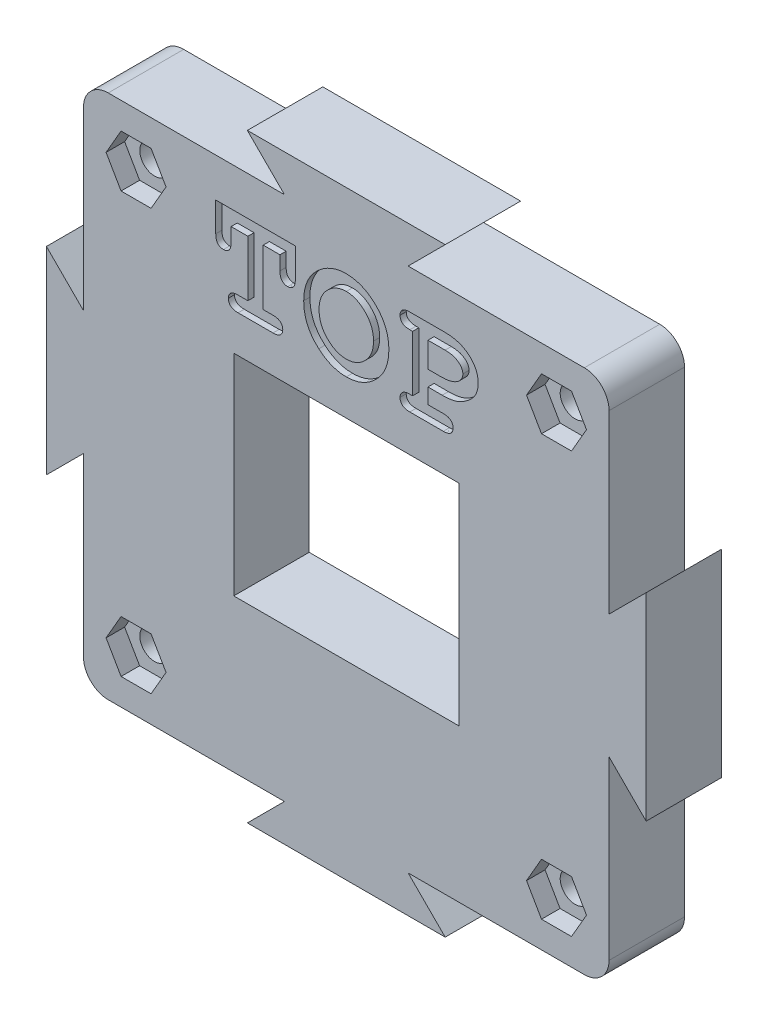
from build123d import *

# Parameters (mm, degrees)
SKETCH1_R           = 1.2
SKETCH1_W           = 18.2
SKETCH1_H           = 17
BOSS_EXTRUDE1_DEPTH = 6.1
CUT_EXTRUDE3_DEPTH  = 1
CUT_EXTRUDE4_DEPTH  = 1.5
CUT_EXTRUDE5_DEPTH  = 0.5


with BuildPart() as part:
    # Sketch1 → Boss-Extrude1 (new body)
    with BuildSketch(Plane.XY):
        with BuildLine():
            Line((-5, 21.25), (-19.25, 21.25))
            ThreePointArc((-19.25, 21.25), (-20.664213562, 20.664213562), (-21.25, 19.25))
            Line((-21.25, 19.25), (-21.25, 5))
            Line((-21.25, 5), (-24.25, 8))
            Line((-24.25, 8), (-24.25, -8))
            Line((-24.25, -8), (-21.25, -5))
            Line((-21.25, -5), (-21.25, -19.25))
            ThreePointArc((-21.25, -19.25), (-20.664213562, -20.664213562), (-19.25, -21.25))
            Line((-19.25, -21.25), (-5, -21.25))
            Line((-5, -21.25), (-8, -24.25))
            Line((-8, -24.25), (8, -24.25))
            Line((8, -24.25), (5, -21.25))
            Line((5, -21.25), (19.25, -21.25))
            ThreePointArc((19.25, -21.25), (20.664213562, -20.664213562), (21.25, -19.25))
            Line((21.25, -19.25), (21.25, -5))
            Line((21.25, -5), (24.25, -8))
            Line((24.25, -8), (24.25, 8))
            Line((24.25, 8), (21.25, 5))
            Line((21.25, 5), (21.25, 19.25))
            ThreePointArc((21.25, 19.25), (20.664213562, 20.664213562), (19.25, 21.25))
            Line((19.25, 21.25), (5, 21.25))
            Line((5, 21.25), (8, 24.25))
            Line((8, 24.25), (-8, 24.25))
            Line((-8, 24.25), (-5, 21.25))
        make_face()
        with Locations((-17, -17)):
            Circle(SKETCH1_R, mode=Mode.SUBTRACT)
        with Locations((17, -17)):
            Circle(SKETCH1_R, mode=Mode.SUBTRACT)
        with Locations((17, 17)):
            Circle(SKETCH1_R, mode=Mode.SUBTRACT)
        with Locations((-17, 17)):
            Circle(SKETCH1_R, mode=Mode.SUBTRACT)
        with Locations((0, -0.4)):
            Rectangle(SKETCH1_W, SKETCH1_H, mode=Mode.SUBTRACT)
    extrude(amount=BOSS_EXTRUDE1_DEPTH)

    # Sketch2 → Cut-Extrude3 (cut)
    with BuildSketch(Plane(origin=(0, 0, 0), x_dir=(-1, 0, 0), z_dir=(0, 0, -1))):
        with BuildLine():
            Line((-9.5, 18.25), (9.5, 18.25))
            ThreePointArc((9.5, 18.25), (10.75, 17), (9.5, 15.75))
            Line((9.5, 15.75), (-9.5, 15.75))
            ThreePointArc((-9.5, 15.75), (-10.75, 17), (-9.5, 18.25))
        make_face()
    extrude(amount=-CUT_EXTRUDE3_DEPTH, mode=Mode.SUBTRACT)

    # Sketch3 → Cut-Extrude4 (cut)
    with BuildSketch(Plane.XY.offset(6.1)):
        Polygon((-18.212435565, -14.9), (-19.424871131, -17), (-18.212435565, -19.1), (-15.787564435, -19.1), (-14.575128869, -17), (-15.787564435, -14.9), align=None)
        Polygon((15.787564435, -14.9), (14.575128869, -17), (15.787564435, -19.1), (18.212435565, -19.1), (19.424871131, -17), (18.212435565, -14.9), align=None)
        Polygon((-18.212435565, 19.1), (-19.424871131, 17), (-18.212435565, 14.9), (-15.787564435, 14.9), (-14.575128869, 17), (-15.787564435, 19.1), align=None)
        Polygon((15.787564435, 19.1), (14.575128869, 17), (15.787564435, 14.9), (18.212435565, 14.9), (19.424871131, 17), (18.212435565, 19.1), align=None)
    extrude(amount=-CUT_EXTRUDE4_DEPTH, mode=Mode.SUBTRACT)

    # Sketch4 → Cut-Extrude5 (cut)
    # profile 1 of 3: a face of its own
    with BuildSketch(Plane.XY.offset(6.1)):
        with BuildLine():
            Line((-6.717741935, 16.858064516), (-6.717741935, 12.341935484))
            Line((-6.717741935, 12.341935484), (-5.927419355, 12.341935484))
            add(Edge.make_bspline(
                [(-5.927419355, 12.341935484), (-5.863148246, 12.340349698), (-5.742415246, 12.337370807), (-5.575414873, 12.304299508), (-5.435165873, 12.250599117), (-5.324117222, 12.172513537), (-5.240499467, 12.077832245), (-5.180080261, 11.970275939), (-5.143989419, 11.8496603), (-5.139440666, 11.764730535), (-5.137096774, 11.720967742)],
                knots=[0, 0, 0, 0, 1.353154287, 2.541894464, 3.570795155, 4.495901044, 5.373971119, 6.211928534, 7.078638652, 8, 8, 8, 8], degree=3))
            add(Edge.make_bspline(
                [(-5.137096774, 11.720967742), (-5.139411719, 11.67718849), (-5.143904296, 11.592226784), (-5.18054359, 11.471340401), (-5.239890455, 11.36255897), (-5.32423841, 11.267819013), (-5.434764703, 11.189183916), (-5.575891283, 11.138241303), (-5.742334201, 11.104365055), (-5.86312009, 11.101516436), (-5.927419355, 11.1)],
                knots=[0, 0, 0, 0, 0.920639213, 1.786670031, 2.634802021, 3.512183892, 4.436564712, 5.460097794, 6.647906274, 8, 8, 8, 8], degree=3))
            Line((-5.927419355, 11.1), (-8.75, 11.1))
            add(Edge.make_bspline(
                [(-8.75, 11.1), (-8.814285929, 11.101533344), (-8.935046767, 11.104413724), (-9.101652606, 11.138083415), (-9.242728791, 11.189834025), (-9.354888209, 11.266612833), (-9.437344663, 11.363255186), (-9.496975861, 11.471245143), (-9.533487954, 11.592252578), (-9.537998419, 11.677197261), (-9.540322581, 11.720967742)],
                knots=[0, 0, 0, 0, 1.351758791, 2.539273031, 3.562552567, 4.496852515, 5.365850662, 6.213772556, 7.079588844, 8, 8, 8, 8], degree=3))
            add(Edge.make_bspline(
                [(-9.540322581, 11.720967742), (-9.537969451, 11.764721754), (-9.533402769, 11.849634476), (-9.497438896, 11.970370805), (-9.436744196, 12.07714303), (-9.355010217, 12.173719777), (-9.242323038, 12.249940289), (-9.102128968, 12.304456905), (-8.934965801, 12.337322371), (-8.814257801, 12.340332871), (-8.75, 12.341935484)],
                knots=[0, 0, 0, 0, 0.921132933, 1.787628184, 2.62537786, 3.495057466, 4.430090083, 5.458735699, 6.647181174, 8, 8, 8, 8], degree=3))
            Line((-8.75, 12.341935484), (-7.959677419, 12.341935484))
            Line((-7.959677419, 12.341935484), (-7.959677419, 16.858064516))
            Line((-7.959677419, 16.858064516), (-9.314516129, 16.858064516))
            Line((-9.314516129, 16.858064516), (-9.314516129, 15.729032258))
            add(Edge.make_bspline(
                [(-9.314516129, 15.729032258), (-9.316118741, 15.664774457), (-9.319129242, 15.544066457), (-9.351994707, 15.37690329), (-9.406511324, 15.23670922), (-9.482731835, 15.124022041), (-9.579308583, 15.042288062), (-9.686080808, 14.981593362), (-9.806817137, 14.945629489), (-9.891729859, 14.941062807), (-9.935483871, 14.938709677)],
                knots=[0, 0, 0, 0, 1.352818826, 2.541264301, 3.569909917, 4.504942534, 5.37462214, 6.212371816, 7.078867067, 8, 8, 8, 8], degree=3))
            add(Edge.make_bspline(
                [(-9.935483871, 14.938709677), (-9.979254352, 14.941033839), (-10.064199035, 14.945544304), (-10.18520647, 14.982056397), (-10.293196427, 15.041687595), (-10.38983878, 15.124144049), (-10.466617587, 15.236303467), (-10.518368198, 15.377379652), (-10.552037889, 15.543985491), (-10.554918269, 15.664746329), (-10.556451613, 15.729032258)],
                knots=[0, 0, 0, 0, 0.920411156, 1.786227444, 2.634149338, 3.503147485, 4.437447433, 5.460726969, 6.648241209, 8, 8, 8, 8], degree=3))
            Line((-10.556451613, 15.729032258), (-10.556451613, 18.1))
            Line((-10.556451613, 18.1), (-4.120967742, 18.1))
            Line((-4.120967742, 18.1), (-4.120967742, 15.729032258))
            add(Edge.make_bspline(
                [(-4.120967742, 15.729032258), (-4.122570354, 15.664774457), (-4.125580855, 15.544066457), (-4.15844632, 15.37690329), (-4.212962937, 15.23670922), (-4.289183448, 15.124022041), (-4.385760196, 15.042288062), (-4.492532421, 14.981593362), (-4.61326875, 14.945629489), (-4.698181472, 14.941062807), (-4.741935484, 14.938709677)],
                knots=[0, 0, 0, 0, 1.352818826, 2.541264301, 3.569909917, 4.504942534, 5.37462214, 6.212371816, 7.078867067, 8, 8, 8, 8], degree=3))
            add(Edge.make_bspline(
                [(-4.741935484, 14.938709677), (-4.785705965, 14.941033839), (-4.870650647, 14.945544304), (-4.991658082, 14.982056397), (-5.09964804, 15.041687595), (-5.196290393, 15.124144049), (-5.2730692, 15.236303467), (-5.324819811, 15.377379652), (-5.358489502, 15.543985491), (-5.361369882, 15.664746329), (-5.362903226, 15.729032258)],
                knots=[0, 0, 0, 0, 0.920411156, 1.786227444, 2.634149338, 3.503147485, 4.437447433, 5.460726969, 6.648241209, 8, 8, 8, 8], degree=3))
            Line((-5.362903226, 15.729032258), (-5.362903226, 16.858064516))
            Line((-5.362903226, 16.858064516), (-6.717741935, 16.858064516))
        make_face()
    # profile 2 of 3: a face of its own
    with BuildSketch(Plane.XY.offset(6.1)):
        with BuildLine():
            add(Edge.make_bspline(
                [(3.443548387, 14.596471774), (3.440768135, 14.469872192), (3.43530187, 14.220964285), (3.384240039, 13.856547556), (3.303430808, 13.508493952), (3.18990528, 13.176073594), (3.043492439, 12.85927086), (2.86230178, 12.559885998), (2.648367688, 12.277756214), (2.407032439, 12.014221053), (2.145091658, 11.774181148), (1.867939271, 11.56507818), (1.582463144, 11.385621278), (1.285073961, 11.239704237), (0.977784758, 11.125989141), (0.659276661, 11.047638273), (0.331615265, 10.995330959), (0.108991475, 10.989861286), (-0.003528226, 10.987096774)],
                knots=[0, 0, 0, 0, 1.094929274, 2.152744503, 3.177137145, 4.182820699, 5.186765039, 6.191160575, 7.204742221, 8.245594793, 9.279258829, 10.274526544, 11.245900401, 12.192545204, 13.135888647, 14.0750236, 15.027068184, 16, 16, 16, 16], degree=3))
            add(Edge.make_bspline(
                [(-0.003528226, 10.987096774), (-0.104783693, 10.990084079), (-0.305676528, 10.996010949), (-0.603005186, 11.03505148), (-0.892607204, 11.102249519), (-1.173562194, 11.198894748), (-1.448464178, 11.318909387), (-1.715948566, 11.466394913), (-1.976145498, 11.640710578), (-2.138659708, 11.775929717), (-2.221018145, 11.844455645)],
                knots=[0, 0, 0, 0, 0.999768647, 1.983560634, 2.955371214, 3.93036818, 4.913148714, 5.913625258, 6.942673607, 8, 8, 8, 8], degree=3))
            add(Edge.make_bspline(
                [(-2.221018145, 11.844455645), (-2.318278926, 11.934209759), (-2.510060195, 12.111189194), (-2.76018462, 12.40823581), (-2.970468425, 12.725657212), (-3.14586036, 13.061370626), (-3.279622713, 13.417629903), (-3.375322538, 13.7931879), (-3.432447151, 14.188380579), (-3.439800111, 14.458681857), (-3.443548387, 14.596471774)],
                knots=[0, 0, 0, 0, 1.020221724, 2.011699023, 2.986768456, 3.952539234, 4.927344826, 5.915360336, 6.937325315, 8, 8, 8, 8], degree=3))
            add(Edge.make_bspline(
                [(-3.443548387, 14.596471774), (-3.439810363, 14.734263637), (-3.432477513, 15.004568732), (-3.375126177, 15.400299201), (-3.279590039, 15.77702639), (-3.146253418, 16.134660388), (-2.970493748, 16.470851099), (-2.759691164, 16.788413268), (-2.510179081, 17.087053018), (-2.318305897, 17.265210858), (-2.221018145, 17.355544355)],
                knots=[0, 0, 0, 0, 1.060651223, 2.080670257, 3.07119143, 4.048377256, 5.012309089, 5.985521871, 6.978575096, 8, 8, 8, 8], degree=3))
            add(Edge.make_bspline(
                [(-2.221018145, 17.355544355), (-2.138652407, 17.424052836), (-1.976123791, 17.559237549), (-1.716031724, 17.733803804), (-1.447955263, 17.880487434), (-1.174391458, 18.003835084), (-0.892169815, 18.097081357), (-0.603073886, 18.165140676), (-0.305658938, 18.203939851), (-0.104777798, 18.209899434), (-0.003528226, 18.212903226)],
                knots=[0, 0, 0, 0, 1.057260928, 2.086245564, 3.086660163, 4.071726737, 5.044811768, 6.016562178, 7.000293253, 8, 8, 8, 8], degree=3))
            add(Edge.make_bspline(
                [(-0.003528226, 18.212903226), (0.108947589, 18.20988414), (0.33139806, 18.203913104), (0.659756114, 18.155311465), (0.977443937, 18.073247517), (1.285215005, 17.960647935), (1.581820697, 17.813915337), (1.869085842, 17.637198447), (2.144430785, 17.42549649), (2.407069631, 17.185877832), (2.648943637, 16.922077374), (2.861818978, 16.638557206), (3.043036954, 16.33936374), (3.190668556, 16.023066596), (3.303633044, 15.689151082), (3.383833481, 15.339249928), (3.435449701, 14.973172224), (3.440813858, 14.72366502), (3.443548387, 14.596471774)],
                knots=[0, 0, 0, 0, 0.971707335, 1.92180653, 2.861011471, 3.803167671, 4.748621076, 5.716093444, 6.713182507, 7.745545627, 8.785088237, 9.801455117, 10.804586573, 11.802659367, 12.811886603, 13.844887421, 14.901371338, 16, 16, 16, 16], degree=3))
        make_face()
        with BuildLine():
            add(Edge.make_bspline(
                [(2.201612903, 14.596471774), (2.199666334, 14.680661835), (2.195853979, 14.845548015), (2.163364121, 15.087203142), (2.109971676, 15.317242791), (2.038769395, 15.537483124), (1.942146655, 15.745183641), (1.824776556, 15.941277134), (1.689229224, 16.128652797), (1.529723468, 16.29851233), (1.3618191, 16.456376066), (1.183521334, 16.593386926), (1.000438128, 16.709495602), (0.8119488, 16.807538593), (0.615505415, 16.87814163), (0.41458012, 16.932479146), (0.20745506, 16.964914384), (0.067147255, 16.968939979), (-0.003528226, 16.970967742)],
                knots=[0, 0, 0, 0, 1.122536616, 2.19848724, 3.244874716, 4.269190481, 5.279843255, 6.292684775, 7.313903152, 8.357465095, 9.395263989, 10.385130857, 11.35119052, 12.28421157, 13.212274806, 14.129235888, 15.057663596, 16, 16, 16, 16], degree=3))
            add(Edge.make_bspline(
                [(-0.003528226, 16.970967742), (-0.073625475, 16.96896849), (-0.212782839, 16.964999567), (-0.41858796, 16.93205665), (-0.618971139, 16.878991632), (-0.813823522, 16.804980592), (-1.001639853, 16.707546507), (-1.186471569, 16.593855277), (-1.362691529, 16.454119626), (-1.53245874, 16.297593674), (-1.688175193, 16.123852922), (-1.8272648, 15.939048714), (-1.941639749, 15.740980762), (-2.038971731, 15.534071422), (-2.109625178, 15.314202579), (-2.163617022, 15.084915627), (-2.195726942, 14.844355676), (-2.199627915, 14.680068421), (-2.201612903, 14.596471774)],
                knots=[0, 0, 0, 0, 0.936482685, 1.859109494, 2.778012839, 3.703447446, 4.638444776, 5.602362168, 6.599140281, 7.639137391, 8.685441249, 9.713490152, 10.724482739, 11.737276228, 12.763761649, 13.804708691, 14.882938341, 16, 16, 16, 16], degree=3))
            add(Edge.make_bspline(
                [(-2.201612903, 14.596471774), (-2.199681627, 14.512865934), (-2.19589968, 14.349143738), (-2.163126113, 14.108717822), (-2.110274658, 13.879735724), (-2.038550944, 13.660175206), (-1.941603874, 13.453779809), (-1.82782704, 13.255810648), (-1.687470142, 13.07259025), (-1.533142356, 12.898748684), (-1.362051131, 12.74422346), (-1.186570733, 12.604248144), (-1.001557989, 12.490872828), (-0.814232255, 12.392766221), (-0.618559604, 12.32151054), (-0.418644254, 12.267794908), (-0.212768495, 12.235038258), (-0.07362067, 12.23104418), (-0.003528226, 12.229032258)],
                knots=[0, 0, 0, 0, 1.118599469, 2.190511572, 3.240559024, 4.260987997, 5.275175755, 6.287560131, 7.310717123, 8.358461383, 9.394553109, 10.392703443, 11.357947819, 12.294232319, 13.218162791, 14.138331151, 15.0622281, 16, 16, 16, 16], degree=3))
            add(Edge.make_bspline(
                [(-0.003528226, 12.229032258), (0.067167036, 12.230992547), (0.207514111, 12.234884192), (0.414202183, 12.268284874), (0.616277134, 12.318900189), (0.811008435, 12.393513546), (1.000989117, 12.488154269), (1.183499692, 12.604976067), (1.361237107, 12.741877316), (1.530296527, 12.897920737), (1.689239997, 13.067855358), (1.824153781, 13.254957013), (1.943201134, 13.450151101), (2.037852493, 13.658195765), (2.110406731, 13.877892359), (2.163278761, 14.107537031), (2.195796065, 14.348567246), (2.199651226, 14.512868171), (2.201612903, 14.596471774)],
                knots=[0, 0, 0, 0, 0.943691391, 1.873454087, 2.789749725, 3.721897961, 4.652721651, 5.620170414, 6.611460613, 7.645425613, 8.690488095, 9.713174884, 10.720729729, 11.739972406, 12.758306802, 13.806198881, 14.883696616, 16, 16, 16, 16], degree=3))
        make_face(mode=Mode.SUBTRACT)
    # profile 3 of 3: a face of its own
    with BuildSketch(Plane.XY.offset(6.1)):
        with BuildLine():
            Line((6.60483871, 13.583870968), (6.60483871, 12.341935484))
            Line((6.60483871, 12.341935484), (7.846774194, 12.341935484))
            add(Edge.make_bspline(
                [(7.846774194, 12.341935484), (7.911045303, 12.340349698), (8.031778303, 12.337370807), (8.198778676, 12.304299508), (8.339027676, 12.250599117), (8.450076326, 12.172513537), (8.533694082, 12.077832245), (8.594113287, 11.970275939), (8.63020413, 11.8496603), (8.634752883, 11.764730535), (8.637096774, 11.720967742)],
                knots=[0, 0, 0, 0, 1.353154287, 2.541894464, 3.570795155, 4.495901044, 5.373971119, 6.211928534, 7.078638652, 8, 8, 8, 8], degree=3))
            add(Edge.make_bspline(
                [(8.637096774, 11.720967742), (8.634781829, 11.67718849), (8.630289253, 11.592226784), (8.593649958, 11.471340401), (8.534303093, 11.36255897), (8.449955138, 11.267819013), (8.339428846, 11.189183916), (8.198302265, 11.138241303), (8.031859348, 11.104365055), (7.911073458, 11.101516436), (7.846774194, 11.1)],
                knots=[0, 0, 0, 0, 0.920639213, 1.786670031, 2.634802021, 3.512183892, 4.436564712, 5.460097794, 6.647906274, 8, 8, 8, 8], degree=3))
            Line((7.846774194, 11.1), (5.137096774, 11.1))
            add(Edge.make_bspline(
                [(5.137096774, 11.1), (5.072810846, 11.101533344), (4.952050007, 11.104413724), (4.785444169, 11.138083415), (4.644367984, 11.189834025), (4.532208565, 11.266612833), (4.449752111, 11.363255186), (4.390120913, 11.471245143), (4.35360882, 11.592252578), (4.349098356, 11.677197261), (4.346774194, 11.720967742)],
                knots=[0, 0, 0, 0, 1.351758791, 2.539273031, 3.562552567, 4.496852515, 5.365850662, 6.213772556, 7.079588844, 8, 8, 8, 8], degree=3))
            add(Edge.make_bspline(
                [(4.346774194, 11.720967742), (4.349127323, 11.764721754), (4.353694006, 11.849634476), (4.389657878, 11.970370805), (4.450352578, 12.07714303), (4.532086557, 12.173719777), (4.644773736, 12.249940289), (4.784967806, 12.304456905), (4.952130973, 12.337322371), (5.072838974, 12.340332871), (5.137096774, 12.341935484)],
                knots=[0, 0, 0, 0, 0.921132933, 1.787628184, 2.62537786, 3.495057466, 4.430090083, 5.458735699, 6.647181174, 8, 8, 8, 8], degree=3))
            Line((5.137096774, 12.341935484), (5.362903226, 12.341935484))
            Line((5.362903226, 12.341935484), (5.362903226, 16.858064516))
            Line((5.362903226, 16.858064516), (5.137096774, 16.858064516))
            add(Edge.make_bspline(
                [(5.137096774, 16.858064516), (5.072810846, 16.85959786), (4.952050007, 16.86247824), (4.785444169, 16.896147931), (4.644367984, 16.947898542), (4.532208565, 17.024677349), (4.449752111, 17.121319702), (4.390120913, 17.229309659), (4.35360882, 17.350317095), (4.349098356, 17.435261777), (4.346774194, 17.479032258)],
                knots=[0, 0, 0, 0, 1.351758791, 2.539273031, 3.562552567, 4.496852515, 5.365850662, 6.213772556, 7.079588844, 8, 8, 8, 8], degree=3))
            add(Edge.make_bspline(
                [(4.346774194, 17.479032258), (4.349127323, 17.52278627), (4.353694006, 17.607698992), (4.389657878, 17.728435321), (4.450352578, 17.835207546), (4.532086557, 17.931784294), (4.644773736, 18.008004805), (4.784967806, 18.062521422), (4.952130973, 18.095386887), (5.072838974, 18.098397388), (5.137096774, 18.1)],
                knots=[0, 0, 0, 0, 0.921132933, 1.787628184, 2.62537786, 3.495057466, 4.430090083, 5.458735699, 6.647181174, 8, 8, 8, 8], degree=3))
            Line((5.137096774, 18.1), (7.966733871, 18.1))
            add(Edge.make_bspline(
                [(7.966733871, 18.1), (8.067953689, 18.097939062), (8.265558597, 18.093915626), (8.553348042, 18.063486693), (8.825526389, 18.014592556), (9.081590886, 17.944737505), (9.321134986, 17.852247357), (9.544562522, 17.740837503), (9.752789085, 17.609987831), (9.941933401, 17.458271414), (10.112522998, 17.293345217), (10.261826377, 17.118104621), (10.388058449, 16.933736301), (10.491144755, 16.740326141), (10.570951709, 16.538431602), (10.62719148, 16.327687697), (10.664448171, 16.108464836), (10.667704214, 15.958522281), (10.669354839, 15.882510081)],
                knots=[0, 0, 0, 0, 1.241595907, 2.423887441, 3.545990142, 4.631120813, 5.674787891, 6.691067699, 7.689784042, 8.685760776, 9.660211043, 10.596862231, 11.505306434, 12.396047468, 13.280220304, 14.162242044, 15.06836304, 16, 16, 16, 16], degree=3))
            add(Edge.make_bspline(
                [(10.669354839, 15.882510081), (10.666061398, 15.798231063), (10.659521696, 15.630880383), (10.614306465, 15.38355212), (10.53884761, 15.143119506), (10.464937374, 14.991981125), (10.427671371, 14.91577621)],
                knots=[0, 0, 0, 0, 1.00499573, 1.995594191, 2.989366067, 4, 4, 4, 4], degree=3))
            add(Edge.make_bspline(
                [(10.427671371, 14.91577621), (10.393137273, 14.858404911), (10.321047374, 14.738642373), (10.180813719, 14.569939261), (10.011556879, 14.401537113), (9.816098133, 14.238431381), (9.604881628, 14.085982489), (9.386694572, 13.951040187), (9.166771546, 13.835872473), (8.93855464, 13.740458358), (8.689601301, 13.66864615), (8.41006874, 13.618845072), (8.094956053, 13.589655574), (7.873301335, 13.585863827), (7.756804435, 13.583870968)],
                knots=[0, 0, 0, 0, 0.770305632, 1.608012352, 2.517893962, 3.517697702, 4.536451801, 5.515651723, 6.46982344, 7.392966776, 8.359531939, 9.447455083, 10.658437892, 12, 12, 12, 12], degree=3))
            Line((7.756804435, 13.583870968), (6.60483871, 13.583870968))
        make_face()
        with BuildLine():
            Line((6.60483871, 14.825806452), (7.719758065, 14.825806452))
            add(Edge.make_bspline(
                [(7.719758065, 14.825806452), (7.783878861, 14.826913555), (7.908164092, 14.829059453), (8.089672999, 14.843039323), (8.261233706, 14.867490473), (8.422695443, 14.902590045), (8.574460523, 14.946726051), (8.715820098, 15.0010249), (8.846599871, 15.066634286), (8.966454634, 15.140430139), (9.074106969, 15.221193311), (9.167887623, 15.30773261), (9.24777576, 15.398063306), (9.314899145, 15.491758096), (9.363480848, 15.592049444), (9.401932764, 15.694361953), (9.423305585, 15.801656362), (9.426041143, 15.874191612), (9.427419355, 15.910735887)],
                knots=[0, 0, 0, 0, 1.374388072, 2.663974064, 3.89925897, 5.085938153, 6.202681255, 7.284082484, 8.326892458, 9.334290039, 10.297261235, 11.207043176, 12.064320358, 12.879029646, 13.66818314, 14.445674875, 15.216909235, 16, 16, 16, 16], degree=3))
            add(Edge.make_bspline(
                [(9.427419355, 15.910735887), (9.423161471, 15.972582932), (9.41460347, 16.09689048), (9.338723376, 16.274242323), (9.217310902, 16.436005915), (9.083947734, 16.556590379), (8.957102503, 16.643626962), (8.847463822, 16.699962212), (8.72960573, 16.749189563), (8.60126466, 16.790881375), (8.461927713, 16.818768027), (8.313244993, 16.843189357), (8.154474367, 16.854127104), (8.045538746, 16.85672969), (7.989667339, 16.858064516)],
                knots=[0, 0, 0, 0, 1.161610864, 2.334743684, 3.571687388, 4.952410177, 5.702465631, 6.465912368, 7.270715245, 8.108423406, 9.004029882, 9.946092044, 10.946582139, 12, 12, 12, 12], degree=3))
            Line((7.989667339, 16.858064516), (6.60483871, 16.858064516))
            Line((6.60483871, 16.858064516), (6.60483871, 14.825806452))
        make_face(mode=Mode.SUBTRACT)
    extrude(amount=-CUT_EXTRUDE5_DEPTH, mode=Mode.SUBTRACT)


solid = part.part
